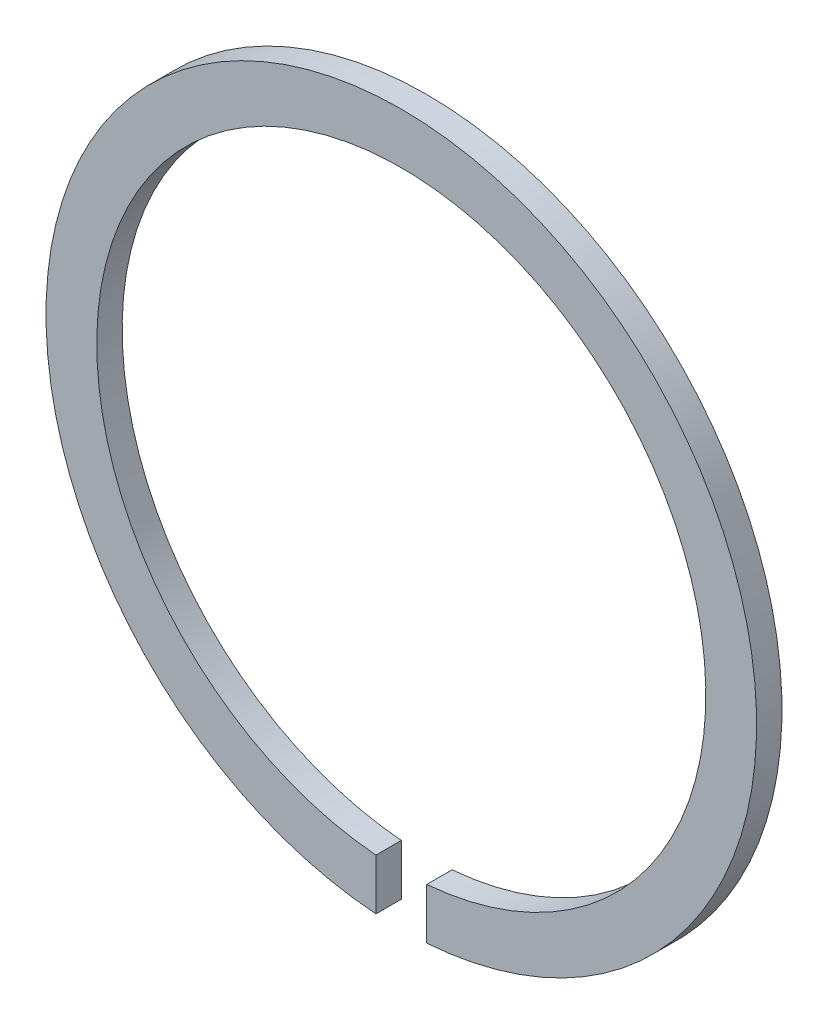
from build123d import *

# Parameters (mm, degrees)
BOSS_EXTRU_1_DEPTH = 0.5


with BuildPart() as part:
    # Esquisse2 → Boss.-Extru.1 (new body)
    with BuildSketch(Plane.XY):
        with BuildLine():
            Line((0.5, -5.979130372), (0.5, -6.982120022))
            ThreePointArc((0.5, -6.982120022), (0, 7), (-0.5, -6.982120022))
            Line((-0.5, -6.982120022), (-0.5, -5.979130372))
            ThreePointArc((-0.5, -5.979130372), (0, 6), (0.5, -5.979130372))
        make_face()
    extrude(amount=BOSS_EXTRU_1_DEPTH)


solid = part.part
